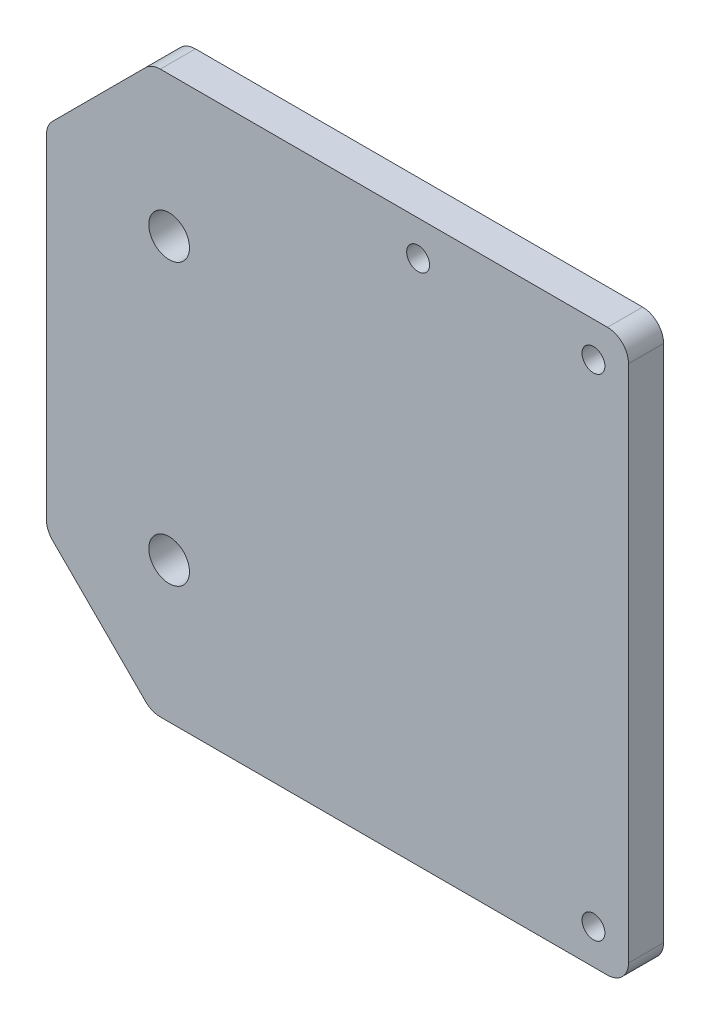
from build123d import *

# Parameters (mm, degrees)
BASE_W                = 83
BASE_H                = 80
MAIN_DEPTH            = 5
GEAR_AXIS_HOLES_D     = 5.8
CHAMFER1_SIZE         = 15
FILLET6_R             = 3
F_4_CLEARANCE_HOLE1_D = 3.2639


with BuildPart() as part:
    # Base → Main (new body)
    with BuildSketch(Plane.XY):
        with Locations((1.724154817, 0)):
            Rectangle(BASE_W, BASE_H)
    extrude(amount=MAIN_DEPTH)

    # Gear Axis Holes (through all)
    with Locations(Plane(origin=(0, 0, 5), x_dir=(-1, 0, 0), z_dir=(0, 0, 1))):
        with Locations((22.275845183, 20), (22.275845183, -20)):
            Hole(GEAR_AXIS_HOLES_D / 2)

    # Chamfer1
    chamfer1_edges = [part.edges().sort_by_distance(p)[0] for p in [
        (-39.775845183, -40, 2.5),
        (-39.775845183, 40, 2.5),
    ]]
    chamfer(chamfer1_edges, length=CHAMFER1_SIZE)

    # Fillet6
    fillet6_edges = [part.edges().sort_by_distance(p)[0] for p in [
        (-24.775845183, -40, 2.5),
        (-39.775845183, -25, 2.5),
        (-39.775845183, 25, 2.5),
        (-24.775845183, 40, 2.5),
        (43.224154817, 40, 2.5),
        (43.224154817, -40, 2.5),
    ]]
    fillet(fillet6_edges, radius=FILLET6_R)

    # #4 Clearance Hole1 (through all)
    with Locations(Plane.XY.offset(5)):
        with Locations((13.224154817, 35), (38.224154817, 35), (38.224154817, -35)):
            Hole(F_4_CLEARANCE_HOLE1_D / 2)


solid = part.part
